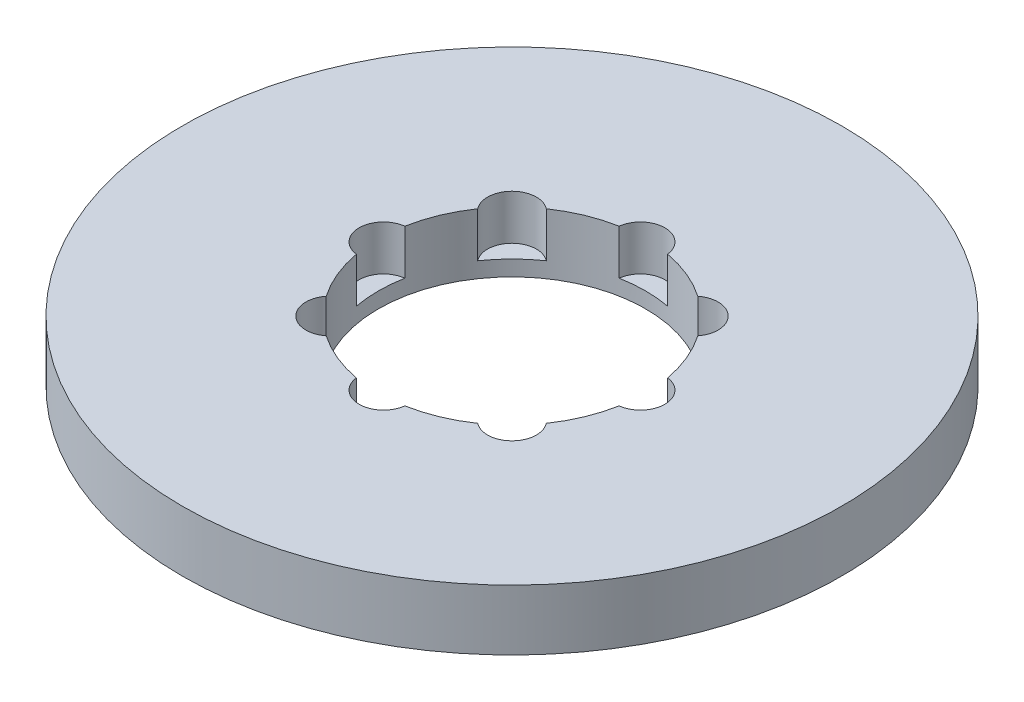
from build123d import *

# Parameters (mm, degrees)
SKETCH1_R           = 92.5
BOSS_EXTRUDE1_DEPTH = 17
SKETCH2_R           = 37.5
CUT_EXTRUDE1_DEPTH  = 132.914745196
SKETCH3_R           = 6.856115291
CUT_EXTRUDE2_DEPTH  = 12.643145523
CIRPATTERN1_COUNT   = 8


with BuildPart() as part:
    # Sketch1 → Boss-Extrude1 (new body)
    with BuildSketch(Plane(origin=(0, 0, 0), x_dir=(1, 0, 0), z_dir=(0, 1, 0))):
        Circle(SKETCH1_R)
    extrude(amount=BOSS_EXTRUDE1_DEPTH)

    # Sketch2 → Cut-Extrude1 (cut, through all)
    with BuildSketch(Plane(origin=(0, 0, 0), x_dir=(1, 0, 0), z_dir=(0, 1, 0))):
        Circle(SKETCH2_R)
    extrude(amount=CUT_EXTRUDE1_DEPTH, mode=Mode.SUBTRACT)

    # Sketch3 → Cut-Extrude2 (cut)
    with BuildSketch(Plane(origin=(0, 17, 0), x_dir=(1, 0, 0), z_dir=(0, 1, 0))):
        with Locations((-36.04956806, 0)):
            Circle(SKETCH3_R)
    cut_extrude2 = extrude(amount=-CUT_EXTRUDE2_DEPTH, mode=Mode.SUBTRACT)

    # CirPattern1: Cut-Extrude2 ×8 about axis
    cirpattern1_axis = Axis((0, 0, 0), (0, 1, 0))
    for i in range(1, CIRPATTERN1_COUNT):
        add(cut_extrude2.rotate(cirpattern1_axis, i * 360 / CIRPATTERN1_COUNT), mode=Mode.SUBTRACT)


solid = part.part
